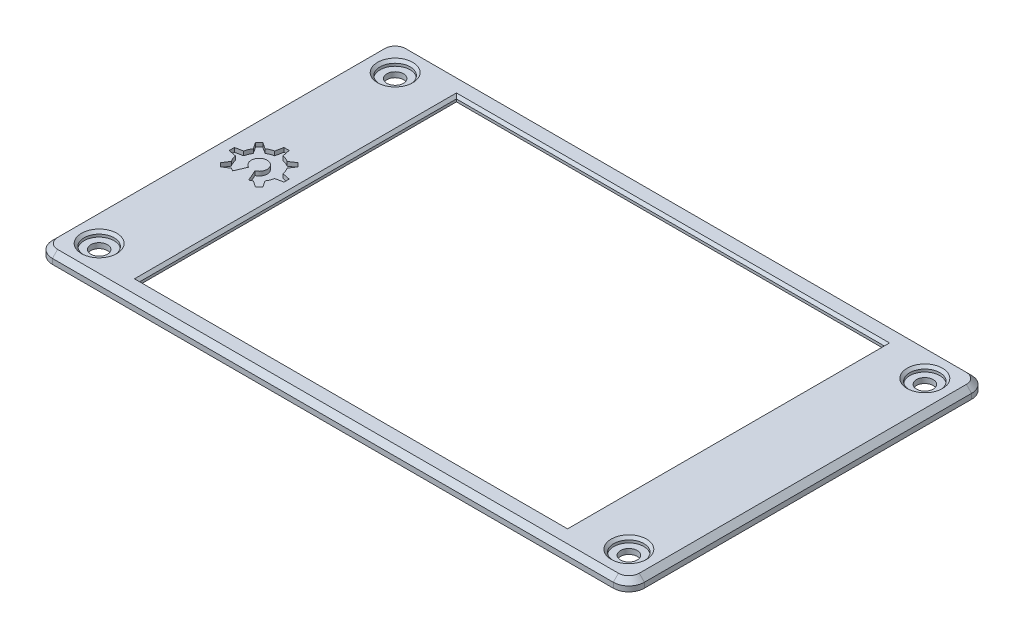
from build123d import *

# Parameters (mm, degrees)
SKETCH1_R           = 1.6
SKETCH1_W           = 82.4
SKETCH1_H           = 61
BOSS_EXTRUDE1_DEPTH = 2
SKETCH2_W           = 84.4
SKETCH2_H           = 63
CUT_EXTRUDE1_DEPTH  = 1
CHAMFER1_SIZE       = 0.5
SKETCH3_R           = 2.9
CUT_EXTRUDE2_DEPTH  = 1
CHAMFER2_SIZE       = 0.5
CHAMFER3_SIZE       = 1
CUT_EXTRUDE3_DEPTH  = 0.8


with BuildPart() as part:
    # Sketch1 → Boss-Extrude1 (new body)
    with BuildSketch(Plane(origin=(0, 0, 0), x_dir=(1, 0, 0), z_dir=(0, 1, 0))):
        with BuildLine():
            Line((3, 0), (111, 0))
            ThreePointArc((111, 0), (113.121320344, 0.878679656), (114, 3))
            Line((114, 3), (114, 66))
            ThreePointArc((114, 66), (113.121320344, 68.121320344), (111, 69))
            Line((111, 69), (3, 69))
            ThreePointArc((3, 69), (0.878679656, 68.121320344), (0, 66))
            Line((0, 66), (0, 3))
            ThreePointArc((0, 3), (0.878679656, 0.878679656), (3, 0))
        make_face()
        with Locations((6, 63)):
            Circle(SKETCH1_R, mode=Mode.SUBTRACT)
        with Locations((6, 6)):
            Circle(SKETCH1_R, mode=Mode.SUBTRACT)
        with Locations((108, 6)):
            Circle(SKETCH1_R, mode=Mode.SUBTRACT)
        with Locations((108, 63)):
            Circle(SKETCH1_R, mode=Mode.SUBTRACT)
        with Locations((57, 34.5)):
            Rectangle(SKETCH1_W, SKETCH1_H, mode=Mode.SUBTRACT)
    extrude(amount=BOSS_EXTRUDE1_DEPTH)

    # Sketch2 → Cut-Extrude1 (cut)
    with BuildSketch(Plane.XZ):
        with Locations((57, -34.5)):
            Rectangle(SKETCH2_W, SKETCH2_H)
    extrude(amount=-CUT_EXTRUDE1_DEPTH, mode=Mode.SUBTRACT)

    # Chamfer1
    chamfer1_edges = [part.edges().sort_by_distance(p)[0] for p in [
        (98.2, 2, -34.5),
        (57, 2, -65),
        (15.8, 2, -34.5),
        (57, 2, -4),
    ]]
    chamfer(chamfer1_edges, length=CHAMFER1_SIZE)

    # Sketch3 → Cut-Extrude2 (cut)
    with BuildSketch(Plane(origin=(0, 2, 0), x_dir=(1, 0, 0), z_dir=(0, 1, 0))):
        with Locations((6, 63)):
            Circle(SKETCH3_R)
        with Locations((108, 63)):
            Circle(SKETCH3_R)
        with Locations((108, 6)):
            Circle(SKETCH3_R)
        with Locations((6, 6)):
            Circle(SKETCH3_R)
    extrude(amount=-CUT_EXTRUDE2_DEPTH, mode=Mode.SUBTRACT)

    # Chamfer2
    chamfer2_edges = [part.edges().sort_by_distance(p)[0] for p in [
        (105.1, 2, -6),
        (105.1, 2, -63),
        (3.1, 2, -6),
        (3.1, 2, -63),
    ]]
    chamfer(chamfer2_edges, length=CHAMFER2_SIZE)

    # Chamfer3
    chamfer3_edges = [part.edges().sort_by_distance(p)[0] for p in [
        (113.121320344, 2, -0.878679656),
        (114, 2, -34.5),
        (113.121320344, 2, -68.121320344),
        (57, 2, -69),
        (0.878679656, 2, -68.121320344),
        (0, 2, -34.5),
        (0.878679656, 2, -0.878679656),
        (57, 2, 0),
    ]]
    chamfer(chamfer3_edges, length=CHAMFER3_SIZE)

    # Sketch4 → Cut-Extrude3 (cut)
    with BuildSketch(Plane(origin=(0, 2, 0), x_dir=(1, 0, 0), z_dir=(0, 1, 0))):
        with BuildLine():
            Line((9.825395701, 30.960299483), (8.89586377, 33.118648479))
            ThreePointArc((8.89586377, 33.118648479), (8.290679151, 36.053871442), (7.685494532, 33.118648479))
            Line((7.685494532, 33.118648479), (6.755962601, 30.960299483))
            ThreePointArc((6.755962601, 30.960299483), (6.457149652, 31.104431492), (6.171741697, 31.273563139))
            Line((6.171741697, 31.273563139), (4.91328092, 30.43936643))
            Line((4.91328092, 30.43936643), (4.55972753, 30.792919821))
            Line((4.55972753, 30.792919821), (4.206174139, 31.146473212))
            Line((4.206174139, 31.146473212), (5.040370847, 32.404933989))
            ThreePointArc((5.040370847, 32.404933989), (4.706026565, 33.039059725), (4.494049066, 33.723871442))
            Line((4.494049066, 33.723871442), (3.014316768, 34.023871442))
            Line((3.014316768, 34.023871442), (3.014316768, 34.523871442))
            Line((3.014316768, 34.523871442), (3.014316768, 35.023871442))
            Line((3.014316768, 35.023871442), (4.494049066, 35.323871442))
            ThreePointArc((4.494049066, 35.323871442), (4.706026565, 36.00868316), (5.040370847, 36.642808896))
            Line((5.040370847, 36.642808896), (4.206174139, 37.901269673))
            Line((4.206174139, 37.901269673), (4.55972753, 38.254823064))
            Line((4.55972753, 38.254823064), (4.91328092, 38.608376454))
            Line((4.91328092, 38.608376454), (6.171741697, 37.774179746))
            ThreePointArc((6.171741697, 37.774179746), (6.805867433, 38.108524028), (7.490679151, 38.320501527))
            Line((7.490679151, 38.320501527), (7.790679151, 39.800233826))
            Line((7.790679151, 39.800233826), (8.290679151, 39.800233826))
            Line((8.290679151, 39.800233826), (8.790679151, 39.800233826))
            Line((8.790679151, 39.800233826), (9.090679151, 38.320501527))
            ThreePointArc((9.090679151, 38.320501527), (9.775490868, 38.108524028), (10.409616604, 37.774179746))
            Line((10.409616604, 37.774179746), (11.668077381, 38.608376454))
            Line((11.668077381, 38.608376454), (12.021630772, 38.254823064))
            Line((12.021630772, 38.254823064), (12.375184163, 37.901269673))
            Line((12.375184163, 37.901269673), (11.540987454, 36.642808896))
            ThreePointArc((11.540987454, 36.642808896), (11.875331737, 36.00868316), (12.087309236, 35.323871442))
            Line((12.087309236, 35.323871442), (13.567041534, 35.023871442))
            Line((13.567041534, 35.023871442), (13.567041534, 34.523871442))
            Line((13.567041534, 34.523871442), (13.567041534, 34.023871442))
            Line((13.567041534, 34.023871442), (12.087309236, 33.723871442))
            ThreePointArc((12.087309236, 33.723871442), (11.875331737, 33.039059725), (11.540987454, 32.404933989))
            Line((11.540987454, 32.404933989), (12.375184163, 31.146473212))
            Line((12.375184163, 31.146473212), (12.021630772, 30.792919821))
            Line((12.021630772, 30.792919821), (11.668077381, 30.43936643))
            Line((11.668077381, 30.43936643), (10.409616604, 31.273563139))
            ThreePointArc((10.409616604, 31.273563139), (10.12420865, 31.104431492), (9.825395701, 30.960299483))
        make_face()
    extrude(amount=-CUT_EXTRUDE3_DEPTH, mode=Mode.SUBTRACT)


solid = part.part
